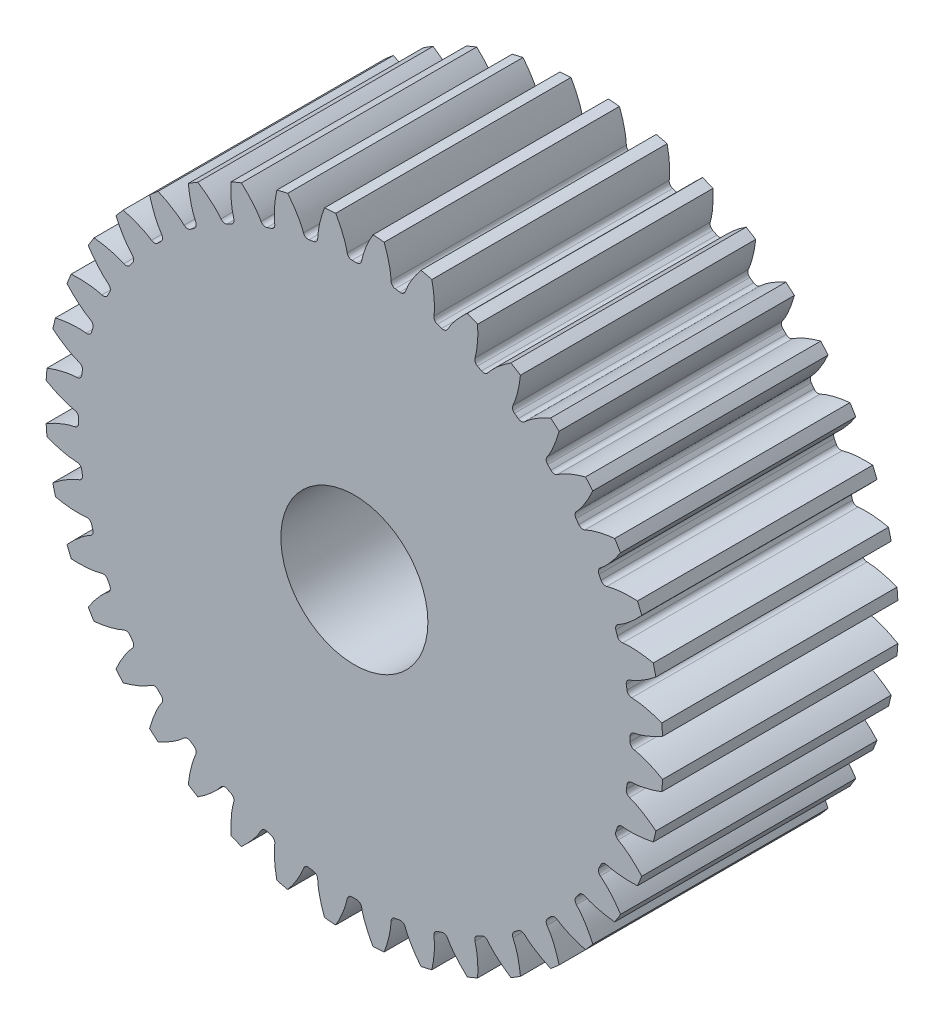
from build123d import *

# Parameters (mm, degrees)
BOSS_EXTRUDE1_DEPTH         = 6.35
BOSS_EXTRUDE1_DEPTH_BACK    = 6.35
SKETCH3_R                   = 16.66875
CUT_EXTRUDE1_DEPTH          = 25.413458443
FILLET1_R                   = 0.266307122
CIRPATTERN1_COUNT           = 40
FILLET1_OF_CIRPATTERN1_R    = 0.266307122
F_5_16_0_3125_DOWEL_HOLE1_D = 7.9375


with BuildPart() as part:
    # Sketch3 → Boss-Extrude1 (new, two sides: drawn at the far end of the back side and taken through both)
    with BuildSketch(Plane.XY.offset(-BOSS_EXTRUDE1_DEPTH_BACK)):
        Circle(SKETCH3_R)
    extrude(amount=BOSS_EXTRUDE1_DEPTH + BOSS_EXTRUDE1_DEPTH_BACK)

    # Sketch4 → Cut-Extrude1 (cut, symmetric)
    with BuildSketch(Plane.XY):
        with BuildLine():
            Line((14.878394914, 0.36259165), (14.913192437, 0.363439678))
            add(Edge.make_bspline(
                [(14.913192437, 0.363439678), (14.915932121, 0.363535365), (14.923613754, 0.363893266), (14.938125953, 0.364923437), (14.961789134, 0.367106592), (14.9919122, 0.370626534), (15.030810507, 0.376023905), (15.076581712, 0.383472603), (15.12682317, 0.392801052), (15.181412661, 0.404183189), (15.235805402, 0.416628993), (15.28999624, 0.43005936), (15.343913358, 0.444353581), (15.409141175, 0.462750391), (15.487236161, 0.486313697), (15.578328649, 0.51604657), (15.681407364, 0.552353468), (15.786194232, 0.592121026), (15.889077748, 0.633523786), (15.992749608, 0.677967317), (16.09285943, 0.722818906), (16.196538779, 0.772080887), (16.292085972, 0.818912247), (16.398778373, 0.874340048), (16.484777514, 0.919934703), (16.573306231, 0.969501611), (16.616347812, 0.993990285), (16.638325167, 1.006658928)],
                knots=[0, 0, 0, 0, 0, 0.005376749, 0.015083688, 0.02853182, 0.04661014, 0.064854849, 0.092110526, 0.119476176, 0.146842496, 0.174208854, 0.201574956, 0.228941013, 0.256307345, 0.307035032, 0.361767352, 0.416499661, 0.471231937, 0.525964282, 0.580696616, 0.635428982, 0.690161387, 0.744893688, 0.799626082, 0.854358407, 0.909090914, 0.909090914, 0.909090914, 0.909090914, 0.909090914], degree=4))
            ThreePointArc((16.638325167, 1.006658928), (16.66875, 0), (16.638325167, -1.006658928))
            add(Edge.make_bspline(
                [(14.913192437, -0.363439678), (14.915932121, -0.363535365), (14.923613754, -0.363893266), (14.938125953, -0.364923437), (14.961789134, -0.367106592), (14.9919122, -0.370626534), (15.030810507, -0.376023905), (15.076581712, -0.383472603), (15.12682317, -0.392801052), (15.181412661, -0.404183189), (15.235805402, -0.416628993), (15.28999624, -0.43005936), (15.343913358, -0.444353581), (15.409141175, -0.462750391), (15.487236161, -0.486313697), (15.578328649, -0.51604657), (15.681407364, -0.552353468), (15.786194232, -0.592121026), (15.889077748, -0.633523786), (15.992749608, -0.677967317), (16.09285943, -0.722818906), (16.196538779, -0.772080887), (16.292085972, -0.818912247), (16.398778373, -0.874340048), (16.484777514, -0.919934703), (16.573306231, -0.969501611), (16.616347812, -0.993990285), (16.638325167, -1.006658928)],
                knots=[0, 0, 0, 0, 0, 0.005376749, 0.015083688, 0.02853182, 0.04661014, 0.064854849, 0.092110526, 0.119476176, 0.146842496, 0.174208854, 0.201574956, 0.228941013, 0.256307345, 0.307035032, 0.361767352, 0.416499661, 0.471231937, 0.525964282, 0.580696616, 0.635428982, 0.690161387, 0.744893688, 0.799626082, 0.854358407, 0.909090914, 0.909090914, 0.909090914, 0.909090914, 0.909090914], degree=4))
            Line((14.913192437, -0.363439678), (14.878394914, -0.36259165))
            ThreePointArc((14.878394914, -0.36259165), (14.8828125, 0), (14.878394914, 0.36259165))
        make_face()
    cut_extrude1 = extrude(amount=CUT_EXTRUDE1_DEPTH, both=True, mode=Mode.SUBTRACT)

    # Fillet1
    fillet1_edges = [part.edges().sort_by_distance(p)[0] for p in [
        (14.878394914, -0.36259165, 0),
        (14.878394914, 0.36259165, 0),
    ]]
    fillet(fillet1_edges, radius=FILLET1_R)

    # CirPattern1: Cut-Extrude1 ×40 about axis
    cirpattern1_axis = Axis((0, 0, 6.35), (0, 0, -1))
    for i in range(1, CIRPATTERN1_COUNT):
        add(cut_extrude1.rotate(cirpattern1_axis, i * 360 / CIRPATTERN1_COUNT), mode=Mode.SUBTRACT)

    # Fillet1 of CirPattern1
    fillet1_of_cirpattern1_edges = [part.edges().sort_by_distance(p)[0] for p in [
        (14.638495352, -2.685621294, 0),
        (14.751939014, -1.969366204, 0),
        (14.038147453, -4.942522029, 0),
        (14.262241416, -4.252831726, 0),
        (13.092133773, -7.077721468, 0),
        (13.421360102, -6.431578416, 0),
        (11.82374831, -9.038643915, 0),
        (12.250000359, -8.451958301, 0),
        (10.264222922, -10.777004951, 0),
        (10.777004951, -10.264222922, 0),
        (8.451958301, -12.250000359, 0),
        (9.038643915, -11.82374831, 0),
        (6.431578416, -13.421360102, 0),
        (7.077721468, -13.092133773, 0),
        (4.252831726, -14.262241416, 0),
        (4.942522029, -14.038147453, 0),
        (1.969366204, -14.751939014, 0),
        (2.685621294, -14.638495352, 0),
        (-0.36259165, -14.878394914, 0),
        (0.36259165, -14.878394914, 0),
        (-2.685621294, -14.638495352, 0),
        (-1.969366204, -14.751939014, 0),
        (-4.942522029, -14.038147453, 0),
        (-4.252831726, -14.262241416, 0),
        (-7.077721468, -13.092133773, 0),
        (-6.431578416, -13.421360102, 0),
        (-9.038643915, -11.82374831, 0),
        (-8.451958301, -12.250000359, 0),
        (-10.777004951, -10.264222922, 0),
        (-10.264222922, -10.777004951, 0),
        (-12.250000359, -8.451958301, 0),
        (-11.82374831, -9.038643915, 0),
        (-13.421360102, -6.431578416, 0),
        (-13.092133773, -7.077721468, 0),
        (-14.262241416, -4.252831726, 0),
        (-14.038147453, -4.942522029, 0),
        (-14.751939014, -1.969366204, 0),
        (-14.638495352, -2.685621294, 0),
        (-14.878394914, 0.36259165, 0),
        (-14.878394914, -0.36259165, 0),
        (-14.638495352, 2.685621294, 0),
        (-14.751939014, 1.969366204, 0),
        (-14.038147453, 4.942522029, 0),
        (-14.262241416, 4.252831726, 0),
        (-13.092133773, 7.077721468, 0),
        (-13.421360102, 6.431578416, 0),
        (-11.82374831, 9.038643915, 0),
        (-12.250000359, 8.451958301, 0),
        (-10.264222922, 10.777004951, 0),
        (-10.777004951, 10.264222922, 0),
        (-8.451958301, 12.250000359, 0),
        (-9.038643915, 11.82374831, 0),
        (-6.431578416, 13.421360102, 0),
        (-7.077721468, 13.092133773, 0),
        (-4.252831726, 14.262241416, 0),
        (-4.942522029, 14.038147453, 0),
        (-1.969366204, 14.751939014, 0),
        (-2.685621294, 14.638495352, 0),
        (0.36259165, 14.878394914, 0),
        (-0.36259165, 14.878394914, 0),
        (2.685621294, 14.638495352, 0),
        (1.969366204, 14.751939014, 0),
        (4.942522029, 14.038147453, 0),
        (4.252831726, 14.262241416, 0),
        (7.077721468, 13.092133773, 0),
        (6.431578416, 13.421360102, 0),
        (9.038643915, 11.82374831, 0),
        (8.451958301, 12.250000359, 0),
        (10.777004951, 10.264222922, 0),
        (10.264222922, 10.777004951, 0),
        (12.250000359, 8.451958301, 0),
        (11.82374831, 9.038643915, 0),
        (13.421360102, 6.431578416, 0),
        (13.092133773, 7.077721468, 0),
        (14.262241416, 4.252831726, 0),
        (14.038147453, 4.942522029, 0),
        (14.751939014, 1.969366204, 0),
        (14.638495352, 2.685621294, 0),
    ]]
    fillet(fillet1_of_cirpattern1_edges, radius=FILLET1_OF_CIRPATTERN1_R)

    # 5/16 (0.3125) Dowel Hole1 (through all)
    with Locations(Plane.XY.offset(6.35)):
        with Locations((0, 0)):
            Hole(F_5_16_0_3125_DOWEL_HOLE1_D / 2)


solid = part.part
